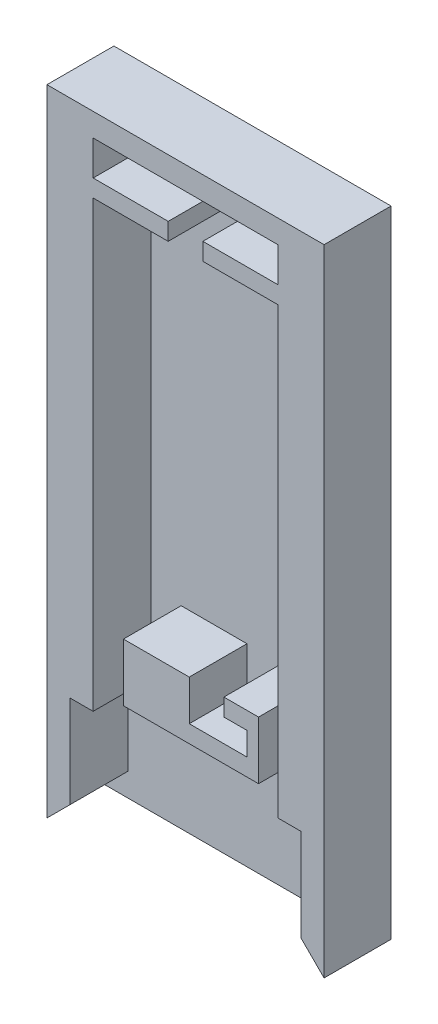
from build123d import *

# Parameters (mm, degrees)
BOSS_EXTRUDE1_DEPTH   = 5
BOSS_EXTRUDE1_2_DEPTH = 5
SKETCH2_W             = 24
SKETCH2_H             = 55
BOSS_EXTRUDE2_DEPTH   = 0.8
SPLIT1_DEPTH          = 5
SPLIT1_2_DEPTH        = 5


# Read off the part's stored shape, not the designer's step: Split1
with BuildPart() as part:
    # Sketch1 → Boss-Extrude1 (new body)
    with BuildSketch(Plane.XY):
        Polygon((4, 53), (20, 53), (20, 50), (13.5, 50), (13.5, 48.5), (20, 48.5), (20, 10), (22, 10), (22, 2), (24, 0), (24, 55), (0, 55), (0, 0), (2, 2), (2, 10), (4, 10), (4, 48.5), (10.5, 48.5), (10.5, 50), (4, 50), align=None)
    extrude(amount=BOSS_EXTRUDE1_DEPTH)



with BuildPart() as body_2:
    # Sketch1 → Boss-Extrude1 2 (new body)
    with BuildSketch(Plane.XY):
        Polygon((8, 18.109227635), (13.7, 18.109227635), (13.7, 17.909227635), (13.7, 14.609227635), (18.7, 14.609227635), (18.7, 16.609227635), (16.7, 16.609227635), (16.7, 18.109227635), (19.7, 18.109227635), (19.7, 13.109227635), (8, 13.109227635), align=None)
    extrude(amount=BOSS_EXTRUDE1_2_DEPTH)


with BuildPart() as part_1:
    add(part.part)

    add(body_2.part)  # Boss-Extrude2 merges body 2
    # Sketch2 → Boss-Extrude2 (add)
    with BuildSketch(Plane(origin=(0, 0, 0), x_dir=(-1, 0, 0), z_dir=(0, 0, -1))):
        with Locations((-12, 27.5)):
            Rectangle(SKETCH2_W, SKETCH2_H)
    extrude(amount=BOSS_EXTRUDE2_DEPTH)

    # Split1 outline → Split1 (cut)
    with BuildSketch(Plane.XY):
        Polygon((8, 18.109227635), (8, 13.109227635), (19.7, 13.109227635), (19.7, 18.109227635), (16.7, 18.109227635), (16.7, 16.609227635), (18.7, 16.609227635), (18.7, 14.609227635), (13.7, 14.609227635), (13.7, 18.109227635), align=None)
    extrude(amount=SPLIT1_DEPTH, mode=Mode.SUBTRACT)


with BuildPart() as body_2_2:
    # Split1 2 outline → Split1 2 (new body)
    with BuildSketch(Plane.XY):
        Polygon((8, 13.109227635), (19.7, 13.109227635), (19.7, 18.109227635), (16.7, 18.109227635), (16.7, 16.609227635), (18.7, 16.609227635), (18.7, 14.609227635), (13.7, 14.609227635), (13.7, 18.109227635), (8, 18.109227635), align=None)
    extrude(amount=SPLIT1_2_DEPTH)


with BuildPart() as body_2_2_1:
    # Body-Move/Copy1: moved
    add(body_2_2.part.moved(Location((0, 0, 1.376257347))))


solid = Compound([part_1.part, body_2_2_1.part])
